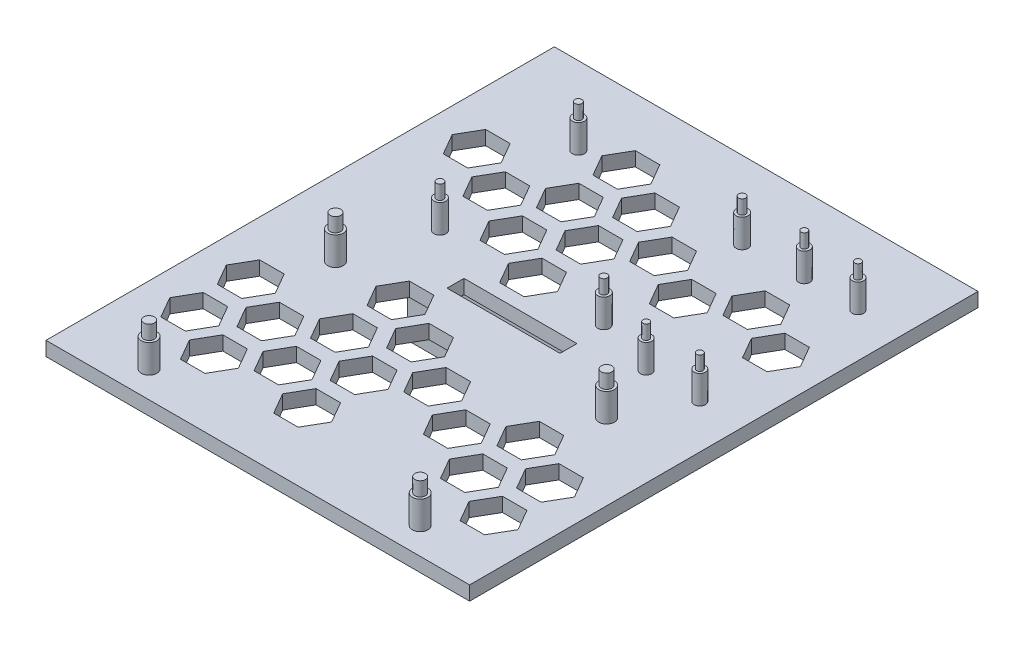
from build123d import *

# Parameters (mm, degrees)
ESQUISSE1_W                     = 62
ESQUISSE1_H                     = 12
ESQUISSE1_W_2                   = 58
ESQUISSE1_H_2                   = 8
BOSS_EXTRU_1_DEPTH              = 15
ESQUISSE2_R                     = 3.175
ENL_V_MAT_EXTRU_1_DEPTH         = 37.469165058
ESQUISSE3_W                     = 150
ESQUISSE3_H                     = 180
BOSS_EXTRU_2_DEPTH              = 5
ENL_V_MAT_EXTRU_3_REACH         = 120.11
ESQUISSE6_W                     = 40
ESQUISSE6_H                     = 6
ESQUISSE11_R                    = 2.75
BOSS_EXTRU_3_DEPTH              = 10
ESQUISSE13_R                    = 2
BOSS_EXTRU_4_DEPTH              = 10
ESQUISSE12_R                    = 2.125
BOSS_EXTRU_5_DEPTH              = 10
ESQUISSE10_R                    = 1.875
BOSS_EXTRU_6_DEPTH              = 15
ESQUISSE9_R                     = 1.125
BOSS_EXTRU_7_DEPTH              = 15
ESQUISSE8_R                     = 1.25
BOSS_EXTRU_8_DEPTH              = 15
ENL_V_MAT_EXTRU_4_DEPTH         = 119.84864324
R_P_TITION_LIN_AIRE1_COUNT      = 7
R_P_TITION_LIN_AIRE1_PITCH      = 20
R_P_TITION_LIN_AIRE1_COUNT_DIR2 = 4
R_P_TITION_LIN_AIRE1_PITCH_DIR2 = 33


with BuildPart() as part:
    # Esquisse1 → Boss.-Extru.1 (new body)
    with BuildSketch(Plane(origin=(0, 0, 0), x_dir=(1, 0, 0), z_dir=(0, 1, 0))):
        Rectangle(ESQUISSE1_W, ESQUISSE1_H)
        Rectangle(ESQUISSE1_W_2, ESQUISSE1_H_2, mode=Mode.SUBTRACT)
    extrude(amount=BOSS_EXTRU_1_DEPTH)

    # Esquisse2 → Enlèv. mat.-Extru.1 (cut, through all)
    with BuildSketch(Plane.XY.offset(6)):
        with Locations((0, 9)):
            Circle(ESQUISSE2_R)
    extrude(amount=-ENL_V_MAT_EXTRU_1_DEPTH, mode=Mode.SUBTRACT)

    # Esquisse3 → Boss.-Extru.2 (add)
    with BuildSketch(Plane(origin=(0, 15, 0), x_dir=(1, 0, 0), z_dir=(0, 1, 0))):
        Rectangle(ESQUISSE3_W, ESQUISSE3_H)
    extrude(amount=BOSS_EXTRU_2_DEPTH)

    # Esquisse6 → Enlèv. mat.-Extru.3 (cut, up to next)
    with BuildSketch(Plane(origin=(0, 15, 0), x_dir=(-1, 0, 0), z_dir=(0, -1, 0)), mode=Mode.PRIVATE) as enl_v_mat_extru_3_sk1:
        Rectangle(ESQUISSE6_W, ESQUISSE6_H)
    enl_v_mat_extru_3_tool1 = extrude(enl_v_mat_extru_3_sk1.sketch, amount=-ENL_V_MAT_EXTRU_3_REACH, mode=Mode.PRIVATE) & part.part
    add(enl_v_mat_extru_3_tool1.solids().sort_by_distance((0, 15, 0))[0], mode=Mode.SUBTRACT)

    # Esquisse11 → Boss.-Extru.3 (add)
    with BuildSketch(Plane(origin=(0, 20, 0), x_dir=(1, 0, 0), z_dir=(0, 1, 0))):
        with Locations((-48, -14.5)):
            Circle(ESQUISSE11_R)
        with Locations((-48, -80.5)):
            Circle(ESQUISSE11_R)
        with Locations((48, -14.5)):
            Circle(ESQUISSE11_R)
        with Locations((48, -80.5)):
            Circle(ESQUISSE11_R)
    extrude(amount=BOSS_EXTRU_3_DEPTH)

    # Esquisse13 → Boss.-Extru.4 (add)
    with BuildSketch(Plane(origin=(0, 20, 0), x_dir=(1, 0, 0), z_dir=(0, 1, 0))):
        with Locations((59.5, 7)):
            Circle(ESQUISSE13_R)
        with Locations((59.5, 63)):
            Circle(ESQUISSE13_R)
        with Locations((40.5, 7)):
            Circle(ESQUISSE13_R)
        with Locations((40.5, 63)):
            Circle(ESQUISSE13_R)
    extrude(amount=BOSS_EXTRU_4_DEPTH)

    # Esquisse12 → Boss.-Extru.5 (add)
    with BuildSketch(Plane(origin=(0, 20, 0), x_dir=(1, 0, 0), z_dir=(0, 1, 0))):
        with Locations((19, 62.5)):
            Circle(ESQUISSE12_R)
        with Locations((19, 13.5)):
            Circle(ESQUISSE12_R)
        with Locations((-39, 62.5)):
            Circle(ESQUISSE12_R)
        with Locations((-39, 13.5)):
            Circle(ESQUISSE12_R)
    extrude(amount=BOSS_EXTRU_5_DEPTH)

    # Esquisse10 → Boss.-Extru.6 (add)
    with BuildSketch(Plane(origin=(0, 20, 0), x_dir=(1, 0, 0), z_dir=(0, 1, 0))):
        with Locations((-48, -14.5)):
            Circle(ESQUISSE10_R)
        with Locations((48, -14.5)):
            Circle(ESQUISSE10_R)
        with Locations((-48, -80.5)):
            Circle(ESQUISSE10_R)
        with Locations((48, -80.5)):
            Circle(ESQUISSE10_R)
    extrude(amount=BOSS_EXTRU_6_DEPTH)

    # Esquisse9 → Boss.-Extru.7 (add)
    with BuildSketch(Plane(origin=(0, 20, 0), x_dir=(1, 0, 0), z_dir=(0, 1, 0))):
        with Locations((59.5, 63)):
            Circle(ESQUISSE9_R)
        with Locations((40.5, 63)):
            Circle(ESQUISSE9_R)
        with Locations((59.5, 7)):
            Circle(ESQUISSE9_R)
        with Locations((40.5, 7)):
            Circle(ESQUISSE9_R)
    extrude(amount=BOSS_EXTRU_7_DEPTH)

    # Esquisse8 → Boss.-Extru.8 (add)
    with BuildSketch(Plane(origin=(0, 20, 0), x_dir=(1, 0, 0), z_dir=(0, 1, 0))):
        with Locations((19, 62.5)):
            Circle(ESQUISSE8_R)
        with Locations((19, 13.5)):
            Circle(ESQUISSE8_R)
        with Locations((-39, 62.5)):
            Circle(ESQUISSE8_R)
        with Locations((-39, 13.5)):
            Circle(ESQUISSE8_R)
    extrude(amount=BOSS_EXTRU_8_DEPTH)

    # Esquisse14 → Enlèv. mat.-Extru.4 (cut, through all)
    with BuildSketch(Plane(origin=(0, 20, 0), x_dir=(1, 0, 0), z_dir=(0, 1, 0))):
        Polygon((-53.169872981, -62.5), (-48.839745962, -55), (-53.169872981, -47.5), (-61.830127019, -47.5), (-66.160254038, -55), (-61.830127019, -62.5), align=None)
        Polygon((-36.715390309, -72), (-32.38526329, -64.5), (-36.715390309, -57), (-45.375644347, -57), (-49.705771366, -64.5), (-45.375644347, -72), align=None)
    enl_v_mat_extru_4 = extrude(amount=-ENL_V_MAT_EXTRU_4_DEPTH, mode=Mode.SUBTRACT)

    # Répétition linéaire1: Enl_v. mat.-Extru.4 7 × 4, 14 skipped
    with Locations(*[(j * R_P_TITION_LIN_AIRE1_PITCH_DIR2, 0, -i * R_P_TITION_LIN_AIRE1_PITCH) for i in range(R_P_TITION_LIN_AIRE1_COUNT) for j in range(R_P_TITION_LIN_AIRE1_COUNT_DIR2) if (i, j) not in ((0, 0), (0, 2), (2, 0), (2, 2), (2, 3), (3, 0), (3, 1), (3, 2), (3, 3), (4, 0), (4, 2), (4, 3), (6, 0), (6, 2), (6, 3))]):
        add(enl_v_mat_extru_4, mode=Mode.SUBTRACT)


solid = part.part
